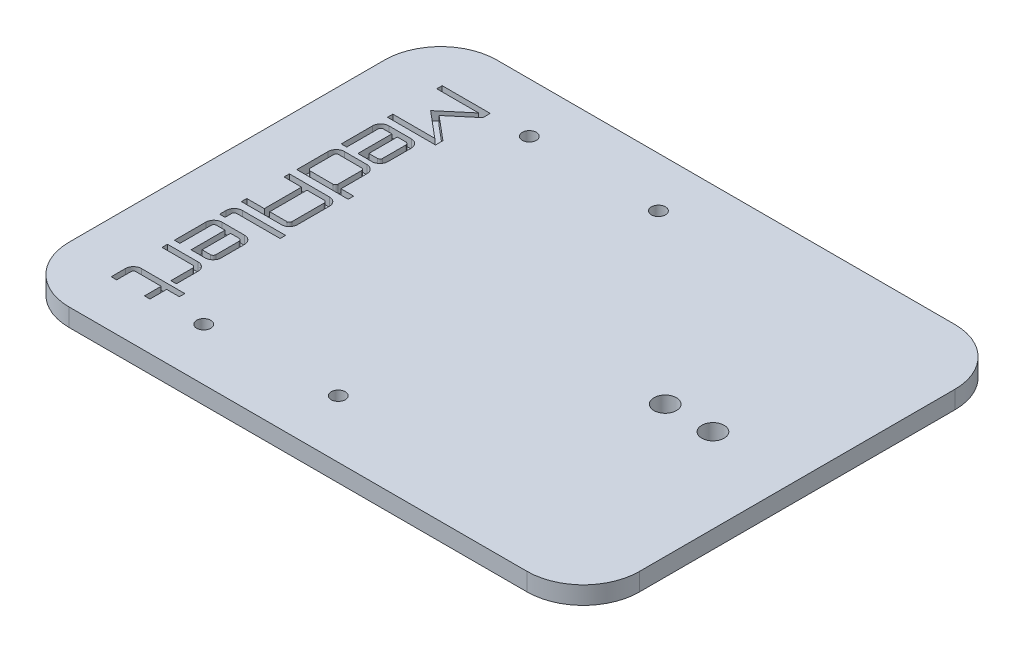
from build123d import *

# Parameters (mm, degrees)
SKETCH1_W           = 101.6
SKETCH1_H           = 76.2
BOSS_EXTRUDE1_DEPTH = 3.175
SKETCH2_R           = 2
CUT_EXTRUDE1_DEPTH  = 64.579325453
FILLET1_R           = 10
SKETCH4_R           = 1.25
CUT_EXTRUDE2_DEPTH  = 64.579325453
CUT_EXTRUDE3_DEPTH  = 1.5875


with BuildPart() as part:
    # Sketch1 → Boss-Extrude1 (new body)
    with BuildSketch(Plane(origin=(0, 0, 0), x_dir=(1, 0, 0), z_dir=(0, 1, 0))):
        Rectangle(SKETCH1_W, SKETCH1_H)
    extrude(amount=BOSS_EXTRUDE1_DEPTH)

    # Sketch2 → Cut-Extrude1 (cut, through all)
    with BuildSketch(Plane(origin=(0, 3.175, 0), x_dir=(1, 0, 0), z_dir=(0, 1, 0))):
        with Locations((35.8, 0)):
            Circle(SKETCH2_R)
        with Locations((27.291, 0)):
            Circle(SKETCH2_R)
    extrude(amount=-CUT_EXTRUDE1_DEPTH, mode=Mode.SUBTRACT)

    # Fillet1
    fillet1_edges = [part.edges().sort_by_distance(p)[0] for p in [
        (-50.8, 1.5875, -38.1),
        (-50.8, 1.5875, 38.1),
        (50.8, 1.5875, 38.1),
        (50.8, 1.5875, -38.1),
    ]]
    fillet(fillet1_edges, radius=FILLET1_R)

    # Sketch4 → Cut-Extrude2 (cut, through all)
    with BuildSketch(Plane(origin=(0, 3.175, 0), x_dir=(1, 0, 0), z_dir=(0, 1, 0))):
        with Locations((-3.134370543, 29.218470634)):
            Circle(SKETCH4_R)
        with Locations((-3.134370543, -27.818050268)):
            Circle(SKETCH4_R)
        with Locations((-26.134370543, 29.218470634)):
            Circle(SKETCH4_R)
        with Locations((-26.134370543, -28.781529366)):
            Circle(SKETCH4_R)
    extrude(amount=-CUT_EXTRUDE2_DEPTH, mode=Mode.SUBTRACT)

    # Sketch5 → Cut-Extrude3 (cut)
    # profile 1 of 8: a face of its own
    with BuildSketch(Plane(origin=(0, 3.175, 0), x_dir=(1, 0, 0), z_dir=(0, 1, 0))):
        Polygon((-41.714230592, 29.273931244), (-33.154430592, 29.273931244), (-33.154430592, 27.954789873), (-37.387034128, 24.399815672), (-33.154430592, 20.844841471), (-33.154430592, 19.5257001), (-41.714230592, 19.5257001), (-41.714230592, 20.488828089), (-34.248268808, 20.488828089), (-38.897081225, 24.399815672), (-34.248268808, 28.310803255), (-41.714230592, 28.310803255), align=None)
    # profile 2 of 8: a face of its own
    with BuildSketch(Plane(origin=(0, 3.175, 0), x_dir=(1, 0, 0), z_dir=(0, 1, 0))):
        with BuildLine():
            add(Edge.make_bspline(
                [(-41.714230592, 16.88741736), (-41.712202655, 16.951845546), (-41.708200637, 17.078990853), (-41.667763496, 17.264233296), (-41.608496053, 17.442088744), (-41.52139129, 17.608473), (-41.414767915, 17.762425862), (-41.292564206, 17.903570415), (-41.151417443, 18.025730049), (-40.997518132, 18.132534349), (-40.830272787, 18.219298696), (-40.653091122, 18.280949464), (-40.467195446, 18.318702486), (-40.340805862, 18.323026855), (-40.276418095, 18.325229857)],
                knots=[0, 0, 0, 0, 1.027217016, 2.02715352, 3.014270877, 4.013201324, 5.0135986, 5.999569355, 6.985540111, 7.985937386, 8.984867834, 9.983630507, 10.972782984, 12, 12, 12, 12], degree=3))
            Line((-40.276418095, 18.325229857), (-36.257078613, 18.325229857))
            add(Edge.make_bspline(
                [(-36.257078613, 18.325229857), (-36.192706319, 18.322959997), (-36.065784313, 18.318484544), (-35.879657952, 18.281552513), (-35.702807278, 18.218849465), (-35.535960075, 18.132588362), (-35.382087657, 18.025714688), (-35.240917391, 17.903578582), (-35.118781285, 17.762408315), (-35.011907611, 17.608535898), (-34.925646508, 17.441688695), (-34.86294346, 17.264838021), (-34.826011429, 17.07871166), (-34.821535976, 16.951789654), (-34.819266116, 16.88741736)],
                knots=[0, 0, 0, 0, 1.027084364, 2.025088736, 3.015087032, 4.013888481, 5.014156569, 6, 6.985843431, 7.986111519, 8.984912968, 9.974911264, 10.972915636, 12, 12, 12, 12], degree=3))
            Line((-34.819266116, 16.88741736), (-34.819266116, 12.751126622))
            add(Edge.make_bspline(
                [(-34.819266116, 12.751126622), (-34.821521309, 12.685040069), (-34.82594932, 12.555280884), (-34.862649634, 12.365647072), (-34.925705942, 12.186615779), (-35.011438059, 12.018310325), (-35.118745743, 11.864021942), (-35.241478514, 11.723008847), (-35.381455096, 11.598889002), (-35.536104242, 11.492487156), (-35.702385771, 11.405265217), (-35.880268447, 11.346028832), (-36.065503623, 11.305583401), (-36.192649924, 11.301582517), (-36.257078613, 11.299555154)],
                knots=[0, 0, 0, 0, 1.048634584, 2.058966034, 3.052054572, 4.053408781, 5.048122636, 6.02849193, 7.014884473, 8.009598329, 9.002853689, 9.984363071, 10.978618772, 12, 12, 12, 12], degree=3))
            Line((-36.257078613, 11.299555154), (-38.754331898, 11.299555154))
            Line((-38.754331898, 11.299555154), (-38.754331898, 17.35178264))
            Line((-38.754331898, 17.35178264), (-40.276418095, 17.35178264))
            add(Edge.make_bspline(
                [(-40.276418095, 17.35178264), (-40.307010937, 17.350242158), (-40.367052556, 17.347218801), (-40.453565175, 17.319680396), (-40.533952598, 17.276341642), (-40.604277118, 17.216012784), (-40.666133623, 17.146922482), (-40.706521439, 17.06573996), (-40.734815441, 16.979296148), (-40.737621004, 16.918616327), (-40.739063504, 16.88741736)],
                knots=[0, 0, 0, 0, 1.007354179, 1.977036842, 2.967724579, 4.002259672, 5.022329906, 6.004122603, 6.973805265, 8, 8, 8, 8], degree=3))
            Line((-40.739063504, 16.88741736), (-40.739063504, 11.299555154))
            Line((-40.739063504, 11.299555154), (-41.714230592, 11.299555154))
            Line((-41.714230592, 11.299555154), (-41.714230592, 16.88741736))
        make_face()
        with BuildLine():
            Line((-37.77916481, 17.35178264), (-37.77916481, 12.286761342))
            Line((-37.77916481, 12.286761342), (-36.257078613, 12.286761342))
            add(Edge.make_bspline(
                [(-36.257078613, 12.286761342), (-36.226460685, 12.288256003), (-36.166369832, 12.291189431), (-36.080476665, 12.319303136), (-35.999293132, 12.359691309), (-35.930203168, 12.421547662), (-35.86987401, 12.491872421), (-35.826536074, 12.572259078), (-35.798819889, 12.659323725), (-35.795922776, 12.719953426), (-35.794433204, 12.751126622)],
                knots=[0, 0, 0, 0, 1.007354179, 1.977036842, 2.958829539, 3.978899773, 5.013434866, 6.004122603, 6.973805265, 8, 8, 8, 8], degree=3))
            Line((-35.794433204, 12.751126622), (-35.794433204, 16.88741736))
            add(Edge.make_bspline(
                [(-35.794433204, 16.88741736), (-35.795915847, 16.918595875), (-35.798799485, 16.97923592), (-35.826613164, 17.06622573), (-35.869364321, 17.146513878), (-35.93074951, 17.215466425), (-35.999701779, 17.276851352), (-36.079990749, 17.319603254), (-36.166428813, 17.347238783), (-36.226480594, 17.350248902), (-36.257078613, 17.35178264)],
                knots=[0, 0, 0, 0, 1.026909697, 1.99726795, 2.988645912, 4.009426841, 5.03020777, 6.021585732, 6.991943984, 8, 8, 8, 8], degree=3))
            Line((-36.257078613, 17.35178264), (-37.77916481, 17.35178264))
        make_face(mode=Mode.SUBTRACT)
    # profile 3 of 8: a face of its own
    with BuildSketch(Plane(origin=(0, 3.175, 0), x_dir=(1, 0, 0), z_dir=(0, 1, 0))):
        with BuildLine():
            add(Edge.make_bspline(
                [(-41.714230592, 8.953650553), (-41.712221556, 9.01979301), (-41.708273492, 9.149773058), (-41.668055971, 9.338533495), (-41.608429869, 9.518550156), (-41.521887325, 9.686433191), (-41.414713989, 9.840669776), (-41.29257856, 9.981850261), (-41.151413534, 10.104000284), (-40.997519184, 10.210807195), (-40.830272505, 10.29757084), (-40.653091196, 10.359221796), (-40.467195426, 10.396974768), (-40.340805856, 10.401299144), (-40.276418095, 10.40350215)],
                knots=[0, 0, 0, 0, 1.049191641, 2.061822075, 3.052470829, 4.054356978, 5.049599247, 6.030489334, 7.011379422, 8.00662169, 9.000404689, 9.994020778, 10.978076193, 12, 12, 12, 12], degree=3))
            Line((-40.276418095, 10.40350215), (-36.257078613, 10.40350215))
            add(Edge.make_bspline(
                [(-36.257078613, 10.40350215), (-36.192706325, 10.401232286), (-36.065784332, 10.396756826), (-35.879657879, 10.359824844), (-35.702807552, 10.297121613), (-35.535959038, 10.2108612), (-35.382091508, 10.103984953), (-35.240903252, 9.981858317), (-35.118834402, 9.840652647), (-35.011413975, 9.686494718), (-34.925712347, 9.518153985), (-34.862647901, 9.339132108), (-34.825949776, 9.149495764), (-34.821521462, 9.019736928), (-34.819266116, 8.953650553)],
                knots=[0, 0, 0, 0, 1.021792034, 2.014653917, 2.999550978, 3.993205832, 4.988319767, 5.969083372, 6.949846977, 7.944960913, 8.946717872, 9.940205837, 10.950943649, 12, 12, 12, 12], degree=3))
            Line((-34.819266116, 8.953650553), (-34.819266116, 4.352994535))
            Line((-34.819266116, 4.352994535), (-32.561074956, 4.352994535))
            Line((-32.561074956, 4.352994535), (-32.561074956, 3.377827446))
            Line((-32.561074956, 3.377827446), (-41.714230592, 3.377827446))
            Line((-41.714230592, 3.377827446), (-41.714230592, 8.953650553))
        make_face()
        with BuildLine():
            Line((-40.739063504, 8.953650553), (-40.739063504, 4.815639944))
            add(Edge.make_bspline(
                [(-40.739063504, 4.815639944), (-40.737562032, 4.785027226), (-40.73461524, 4.724946599), (-40.706599302, 4.638978628), (-40.665634815, 4.557690432), (-40.604831642, 4.487226397), (-40.534367606, 4.426423223), (-40.45307941, 4.385458736), (-40.36711144, 4.357442799), (-40.307030812, 4.354496006), (-40.276418095, 4.352994535)],
                knots=[0, 0, 0, 0, 1.009027997, 1.980321883, 2.963745925, 4, 5.036254075, 6.019678117, 6.990972003, 8, 8, 8, 8], degree=3))
            Line((-40.276418095, 4.352994535), (-36.257078613, 4.352994535))
            add(Edge.make_bspline(
                [(-36.257078613, 4.352994535), (-36.226460685, 4.354489196), (-36.166369833, 4.357422623), (-36.080476661, 4.385536332), (-35.999293144, 4.42592449), (-35.930203121, 4.487780899), (-35.869874187, 4.558105446), (-35.826535452, 4.638492862), (-35.798997042, 4.725005483), (-35.795973686, 4.785047102), (-35.794433204, 4.815639944)],
                knots=[0, 0, 0, 0, 1.009732169, 1.981703892, 2.965814237, 3.988292478, 5.025269725, 6.018296108, 6.990267831, 8, 8, 8, 8], degree=3))
            Line((-35.794433204, 4.815639944), (-35.794433204, 8.953650553))
            add(Edge.make_bspline(
                [(-35.794433204, 8.953650553), (-35.795966942, 8.984248572), (-35.79897706, 9.044300352), (-35.826612593, 9.13073842), (-35.86936448, 9.211027375), (-35.930749467, 9.279979698), (-35.99970179, 9.341364685), (-36.079990746, 9.384116572), (-36.166428814, 9.411752105), (-36.226480594, 9.414762224), (-36.257078613, 9.416295961)],
                knots=[0, 0, 0, 0, 1.010437324, 1.983087831, 2.976807703, 4, 5.023192297, 6.016912169, 6.989562676, 8, 8, 8, 8], degree=3))
            Line((-36.257078613, 9.416295961), (-40.276418095, 9.416295961))
            add(Edge.make_bspline(
                [(-40.276418095, 9.416295961), (-40.307010937, 9.414755479), (-40.367052555, 9.411732123), (-40.453565176, 9.384193713), (-40.533952592, 9.340854979), (-40.604277139, 9.280526045), (-40.666133548, 9.211436022), (-40.706521706, 9.130252504), (-40.734635416, 9.044359333), (-40.737568843, 8.98426848), (-40.739063504, 8.953650553)],
                knots=[0, 0, 0, 0, 1.009732169, 1.981703892, 2.974730275, 4.011707522, 5.034185763, 6.018296108, 6.990267831, 8, 8, 8, 8], degree=3))
        make_face(mode=Mode.SUBTRACT)
    # profile 4 of 8: a face of its own
    with BuildSketch(Plane(origin=(0, 3.175, 0), x_dir=(1, 0, 0), z_dir=(0, 1, 0))):
        with BuildLine():
            Line((-41.714230592, 2.062125819), (-34.581923861, 2.062125819))
            add(Edge.make_bspline(
                [(-34.581923861, 2.062125819), (-34.51752073, 2.059946903), (-34.390537922, 2.055650763), (-34.205222364, 2.017481893), (-34.02728682, 1.959965884), (-33.861510954, 1.874236203), (-33.706472823, 1.771489086), (-33.56610203, 1.651106405), (-33.44456763, 1.511647623), (-33.34239086, 1.356709591), (-33.2565718, 1.191004236), (-33.199079563, 1.013049938), (-33.160904336, 0.827739395), (-33.156609066, 0.700755901), (-33.154430592, 0.636352421)],
                knots=[0, 0, 0, 0, 1.032216714, 2.035208122, 3.024182869, 4.023794347, 5.018739673, 6.003470517, 6.981260327, 7.976205653, 8.975817131, 9.964791878, 10.967783286, 12, 12, 12, 12], degree=3))
            Line((-33.154430592, 0.636352421), (-33.154430592, -5.070180912))
            add(Edge.make_bspline(
                [(-33.154430592, -5.070180912), (-33.156542973, -5.134599385), (-33.160689459, -5.261049242), (-33.199666595, -5.446142016), (-33.256124602, -5.624412971), (-33.342465046, -5.790495654), (-33.44446762, -5.945579567), (-33.566673078, -6.084852617), (-33.705852561, -6.207178855), (-33.861593547, -6.309690188), (-34.027264928, -6.395539262), (-34.205228262, -6.453023516), (-34.390536388, -6.491200878), (-34.517520214, -6.495495855), (-34.581923861, -6.497674181)],
                knots=[0, 0, 0, 0, 1.03172279, 2.025214077, 3.022441902, 4.021575058, 5.016044295, 5.993366225, 6.983661833, 7.97813107, 8.977264226, 9.965765741, 10.96827721, 12, 12, 12, 12], degree=3))
            Line((-34.581923861, -6.497674181), (-41.714230592, -6.497674181))
            Line((-41.714230592, -6.497674181), (-41.714230592, -5.534546192))
            Line((-41.714230592, -5.534546192), (-38.587504372, -5.534546192))
            Line((-38.587504372, -5.534546192), (-38.587504372, 1.09899783))
            Line((-38.587504372, 1.09899783), (-41.714230592, 1.09899783))
            Line((-41.714230592, 1.09899783), (-41.714230592, 2.062125819))
        make_face()
        with BuildLine():
            Line((-37.624376383, 1.09899783), (-37.624376383, -5.534546192))
            Line((-37.624376383, -5.534546192), (-34.581923861, -5.534546192))
            add(Edge.make_bspline(
                [(-34.581923861, -5.534546192), (-34.550724894, -5.533103692), (-34.490045072, -5.530298129), (-34.403601265, -5.502004131), (-34.322418726, -5.461616301), (-34.253328485, -5.399759852), (-34.192999403, -5.329435119), (-34.149661447, -5.249048455), (-34.121945267, -5.16198381), (-34.119048153, -5.101354109), (-34.117558581, -5.070180912)],
                knots=[0, 0, 0, 0, 1.023783653, 1.991188011, 2.970673951, 3.988347493, 5.020451908, 6.008811989, 6.976216347, 8, 8, 8, 8], degree=3))
            Line((-34.117558581, -5.070180912), (-34.117558581, 0.636352421))
            add(Edge.make_bspline(
                [(-34.117558581, 0.636352421), (-34.119092319, 0.666950441), (-34.122102438, 0.727002221), (-34.149737967, 0.813440285), (-34.19248987, 0.893729255), (-34.253874796, 0.962681524), (-34.322827343, 1.024066713), (-34.403115491, 1.066817871), (-34.490105301, 1.09463155), (-34.550745346, 1.097515187), (-34.581923861, 1.09899783)],
                knots=[0, 0, 0, 0, 1.008056016, 1.978414268, 2.96979223, 3.990573159, 5.011354088, 6.00273205, 6.973090303, 8, 8, 8, 8], degree=3))
            Line((-34.581923861, 1.09899783), (-37.624376383, 1.09899783))
        make_face(mode=Mode.SUBTRACT)
    # profile 5 of 8: a face of its own
    with BuildSketch(Plane(origin=(0, 3.175, 0), x_dir=(1, 0, 0), z_dir=(0, 1, 0))):
        with BuildLine():
            add(Edge.make_bspline(
                [(-41.714230592, -9.211631264), (-41.712202655, -9.147203077), (-41.708200638, -9.020057766), (-41.667763493, -8.834815343), (-41.608496065, -8.656959821), (-41.521391245, -8.490575847), (-41.414768084, -8.336621932), (-41.292563588, -8.195481255), (-41.151419768, -8.073307131), (-40.997509321, -7.966557653), (-40.830305598, -7.879588389), (-40.652861155, -7.818662383), (-40.467427317, -7.778051189), (-40.340845602, -7.774106607), (-40.276418095, -7.772098895)],
                knots=[0, 0, 0, 0, 1.02706128, 2.026846186, 3.013813887, 4.012592888, 5.012838495, 5.998659769, 6.984481042, 7.984726649, 8.98350565, 9.982116902, 10.97293872, 12, 12, 12, 12], degree=3))
            Line((-40.276418095, -7.772098895), (-32.561074956, -7.772098895))
            Line((-32.561074956, -7.772098895), (-32.561074956, -8.747265984))
            Line((-32.561074956, -8.747265984), (-40.276418095, -8.747265984))
            add(Edge.make_bspline(
                [(-40.276418095, -8.747265984), (-40.307010937, -8.748806466), (-40.367052556, -8.751829823), (-40.453565175, -8.779368228), (-40.533952598, -8.822706982), (-40.604277118, -8.88303584), (-40.666133623, -8.952126141), (-40.706521439, -9.033308664), (-40.734815441, -9.119752476), (-40.737621004, -9.180432297), (-40.739063504, -9.211631264)],
                knots=[0, 0, 0, 0, 1.007354179, 1.977036842, 2.967724579, 4.002259672, 5.022329906, 6.004122603, 6.973805265, 8, 8, 8, 8], degree=3))
            Line((-40.739063504, -9.211631264), (-40.739063504, -10.375984207))
            Line((-40.739063504, -10.375984207), (-41.714230592, -10.375984207))
            Line((-41.714230592, -10.375984207), (-41.714230592, -9.211631264))
        make_face()
    # profile 6 of 8: a face of its own
    with BuildSketch(Plane(origin=(0, 3.175, 0), x_dir=(1, 0, 0), z_dir=(0, 1, 0))):
        with BuildLine():
            add(Edge.make_bspline(
                [(-41.714230592, -12.831960579), (-41.712202655, -12.767532393), (-41.708200637, -12.640387085), (-41.667763496, -12.455144642), (-41.608496053, -12.277289195), (-41.52139129, -12.110904939), (-41.414767915, -11.956952076), (-41.292564206, -11.815807523), (-41.151417443, -11.69364789), (-40.997518132, -11.586843589), (-40.830272787, -11.500079243), (-40.653091122, -11.438428474), (-40.467195446, -11.400675453), (-40.340805862, -11.396351083), (-40.276418095, -11.394148081)],
                knots=[0, 0, 0, 0, 1.027217016, 2.02715352, 3.014270877, 4.013201324, 5.0135986, 5.999569355, 6.985540111, 7.985937386, 8.984867834, 9.983630507, 10.972782984, 12, 12, 12, 12], degree=3))
            Line((-40.276418095, -11.394148081), (-36.257078613, -11.394148081))
            add(Edge.make_bspline(
                [(-36.257078613, -11.394148081), (-36.192706319, -11.396417941), (-36.065784313, -11.400893395), (-35.879657952, -11.437825425), (-35.702807278, -11.500528474), (-35.535960075, -11.586789577), (-35.382087657, -11.693663251), (-35.240917391, -11.815799356), (-35.118781285, -11.956969623), (-35.011907611, -12.110842041), (-34.925646508, -12.277689243), (-34.86294346, -12.454539918), (-34.826011429, -12.640666278), (-34.821535976, -12.767588284), (-34.819266116, -12.831960579)],
                knots=[0, 0, 0, 0, 1.027084364, 2.025088736, 3.015087032, 4.013888481, 5.014156569, 6, 6.985843431, 7.986111519, 8.984912968, 9.974911264, 10.972915636, 12, 12, 12, 12], degree=3))
            Line((-34.819266116, -12.831960579), (-34.819266116, -16.968251316))
            add(Edge.make_bspline(
                [(-34.819266116, -16.968251316), (-34.821521309, -17.03433787), (-34.82594932, -17.164097055), (-34.862649634, -17.353730866), (-34.925705942, -17.53276216), (-35.011438059, -17.701067614), (-35.118745743, -17.855355997), (-35.241478514, -17.996369092), (-35.381455096, -18.120488937), (-35.536104242, -18.226890783), (-35.702385771, -18.314112722), (-35.880268447, -18.373349106), (-36.065503623, -18.413794537), (-36.192649924, -18.417795422), (-36.257078613, -18.419822785)],
                knots=[0, 0, 0, 0, 1.048634584, 2.058966034, 3.052054572, 4.053408781, 5.048122636, 6.02849193, 7.014884473, 8.009598329, 9.002853689, 9.984363071, 10.978618772, 12, 12, 12, 12], degree=3))
            Line((-36.257078613, -18.419822785), (-38.754331898, -18.419822785))
            Line((-38.754331898, -18.419822785), (-38.754331898, -12.367595298))
            Line((-38.754331898, -12.367595298), (-40.276418095, -12.367595298))
            add(Edge.make_bspline(
                [(-40.276418095, -12.367595298), (-40.307010937, -12.369135781), (-40.367052556, -12.372159138), (-40.453565175, -12.399697543), (-40.533952598, -12.443036297), (-40.604277118, -12.503365155), (-40.666133623, -12.572455456), (-40.706521439, -12.653637979), (-40.734815441, -12.740081791), (-40.737621004, -12.800761612), (-40.739063504, -12.831960579)],
                knots=[0, 0, 0, 0, 1.007354179, 1.977036842, 2.967724579, 4.002259672, 5.022329906, 6.004122603, 6.973805265, 8, 8, 8, 8], degree=3))
            Line((-40.739063504, -12.831960579), (-40.739063504, -18.419822785))
            Line((-40.739063504, -18.419822785), (-41.714230592, -18.419822785))
            Line((-41.714230592, -18.419822785), (-41.714230592, -12.831960579))
        make_face()
        with BuildLine():
            Line((-37.77916481, -12.367595298), (-37.77916481, -17.432616596))
            Line((-37.77916481, -17.432616596), (-36.257078613, -17.432616596))
            add(Edge.make_bspline(
                [(-36.257078613, -17.432616596), (-36.226460685, -17.431121935), (-36.166369832, -17.428188508), (-36.080476665, -17.400074802), (-35.999293132, -17.35968663), (-35.930203168, -17.297830277), (-35.86987401, -17.227505517), (-35.826536074, -17.14711886), (-35.798819889, -17.060054213), (-35.795922776, -16.999424513), (-35.794433204, -16.968251316)],
                knots=[0, 0, 0, 0, 1.007354179, 1.977036842, 2.958829539, 3.978899773, 5.013434866, 6.004122603, 6.973805265, 8, 8, 8, 8], degree=3))
            Line((-35.794433204, -16.968251316), (-35.794433204, -12.831960579))
            add(Edge.make_bspline(
                [(-35.794433204, -12.831960579), (-35.795915847, -12.800782063), (-35.798799485, -12.740142019), (-35.826613164, -12.653152209), (-35.869364321, -12.572864061), (-35.93074951, -12.503911513), (-35.999701779, -12.442526587), (-36.079990749, -12.399774684), (-36.166428813, -12.372139155), (-36.226480594, -12.369129036), (-36.257078613, -12.367595298)],
                knots=[0, 0, 0, 0, 1.026909697, 1.99726795, 2.988645912, 4.009426841, 5.03020777, 6.021585732, 6.991943984, 8, 8, 8, 8], degree=3))
            Line((-36.257078613, -12.367595298), (-37.77916481, -12.367595298))
        make_face(mode=Mode.SUBTRACT)
    # profile 7 of 8: a face of its own
    with BuildSketch(Plane(origin=(0, 3.175, 0), x_dir=(1, 0, 0), z_dir=(0, 1, 0))):
        with BuildLine():
            Line((-41.714230592, -19.65985007), (-36.257078613, -19.65985007))
            add(Edge.make_bspline(
                [(-36.257078613, -19.65985007), (-36.192667344, -19.661926575), (-36.06555542, -19.666024437), (-35.879883583, -19.705800019), (-35.702775245, -19.767791189), (-35.535968708, -19.85425433), (-35.38208538, -19.961073796), (-35.240917997, -20.083224229), (-35.11878112, -20.224390663), (-35.011907656, -20.378264122), (-34.925646497, -20.545111045), (-34.862943463, -20.721961794), (-34.826011428, -20.908088135), (-34.821535975, -21.035010144), (-34.819266116, -21.099382439)],
                knots=[0, 0, 0, 0, 1.026930068, 2.026587245, 3.016436816, 4.015088217, 5.015206038, 6.000901367, 6.986596697, 7.986714517, 8.985365918, 9.975215489, 10.973069932, 12, 12, 12, 12], degree=3))
            Line((-34.819266116, -21.099382439), (-34.819266116, -24.974252723))
            Line((-34.819266116, -24.974252723), (-35.794433204, -24.974252723))
            Line((-35.794433204, -24.974252723), (-35.794433204, -21.099382439))
            add(Edge.make_bspline(
                [(-35.794433204, -21.099382439), (-35.795915847, -21.068203924), (-35.798799485, -21.007563879), (-35.826613164, -20.920574069), (-35.869364321, -20.840285921), (-35.93074951, -20.771333374), (-35.999701779, -20.709948448), (-36.079990749, -20.667196545), (-36.166428813, -20.639561016), (-36.226480594, -20.636550897), (-36.257078613, -20.635017159)],
                knots=[0, 0, 0, 0, 1.026909697, 1.99726795, 2.988645912, 4.009426841, 5.03020777, 6.021585732, 6.991943984, 8, 8, 8, 8], degree=3))
            Line((-36.257078613, -20.635017159), (-41.714230592, -20.635017159))
            Line((-41.714230592, -20.635017159), (-41.714230592, -19.65985007))
        make_face()
    # profile 8 of 8: a face of its own
    with BuildSketch(Plane(origin=(0, 3.175, 0), x_dir=(1, 0, 0), z_dir=(0, 1, 0))):
        with BuildLine():
            add(Edge.make_bspline(
                [(-41.714230592, -27.165368897), (-41.7122222, -27.09922583), (-41.708275402, -26.969244586), (-41.668048707, -26.780492821), (-41.608456607, -26.60044402), (-41.521786444, -26.432681614), (-41.415330022, -26.278353422), (-41.291807291, -26.139086937), (-41.15253295, -26.016271338), (-40.996722321, -25.91388384), (-40.83065297, -25.827527094), (-40.652378452, -25.771073443), (-40.467286619, -25.732095156), (-40.340836633, -25.727948829), (-40.276418095, -25.725836528)],
                knots=[0, 0, 0, 0, 1.051561752, 2.066479706, 3.059366323, 4.063515721, 5.06100623, 6.037267067, 7.020372973, 8.007622208, 8.9995015, 9.989489295, 10.975767679, 12, 12, 12, 12], degree=3))
            Line((-40.276418095, -25.725836528), (-32.561074956, -25.725836528))
            Line((-32.561074956, -25.725836528), (-32.561074956, -26.701003617))
            Line((-32.561074956, -26.701003617), (-34.819266116, -26.701003617))
            Line((-34.819266116, -26.701003617), (-34.819266116, -29.68498051))
            Line((-34.819266116, -29.68498051), (-35.794433204, -29.68498051))
            Line((-35.794433204, -29.68498051), (-35.794433204, -26.701003617))
            Line((-35.794433204, -26.701003617), (-40.276418095, -26.701003617))
            add(Edge.make_bspline(
                [(-40.276418095, -26.701003617), (-40.307010937, -26.702544099), (-40.367052556, -26.705567456), (-40.453565175, -26.733105861), (-40.533952598, -26.776444615), (-40.604277118, -26.836773473), (-40.666133623, -26.905863774), (-40.706521439, -26.987046297), (-40.734815441, -27.073490109), (-40.737621004, -27.13416993), (-40.739063504, -27.165368897)],
                knots=[0, 0, 0, 0, 1.007354179, 1.977036842, 2.967724579, 4.002259672, 5.022329906, 6.004122603, 6.973805265, 8, 8, 8, 8], degree=3))
            Line((-40.739063504, -27.165368897), (-40.739063504, -29.68498051))
            Line((-40.739063504, -29.68498051), (-41.714230592, -29.68498051))
            Line((-41.714230592, -29.68498051), (-41.714230592, -27.165368897))
        make_face()
    extrude(amount=-CUT_EXTRUDE3_DEPTH, mode=Mode.SUBTRACT)


solid = part.part
